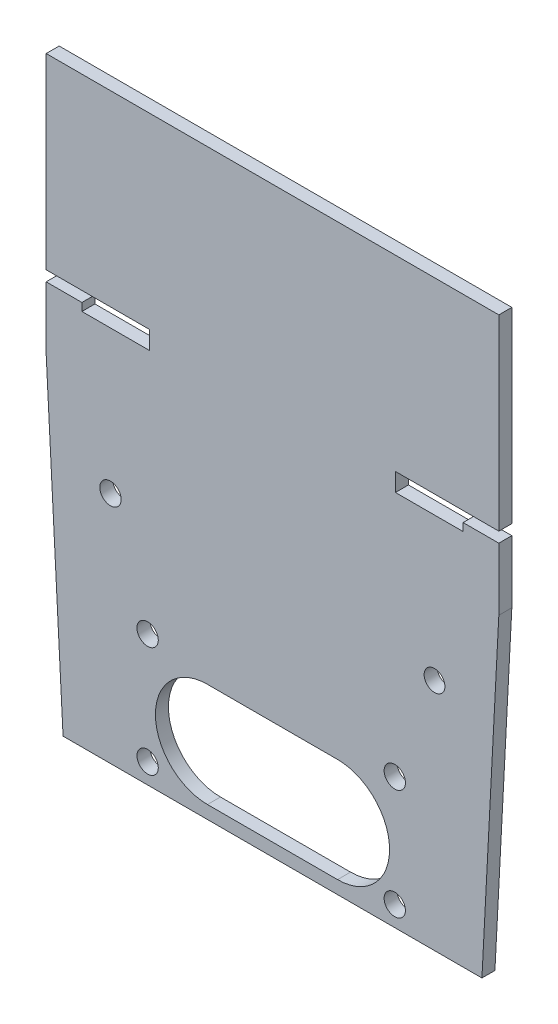
from build123d import *

# Parameters (mm, degrees)
BOSS_EXTRUDE1_DEPTH     = 5
CHAMFER1_SIZE           = 2
BOSS_EXTRUDE4_START     = 80
BOSS_EXTRUDE4_OUTLINE_W = 26
BOSS_EXTRUDE4_OUTLINE_H = 5
BOSS_EXTRUDE4_DEPTH     = 3
SKETCH2_R               = 4.1
SKETCH2_R_2             = 4
CUT_EXTRUDE2_DEPTH      = 36.925038653
SKETCH4_R               = 4.1
CUT_EXTRUDE3_DEPTH      = 9.191294825
SKETCH5_W               = 174
SKETCH5_H               = 5
BOSS_EXTRUDE5_DEPTH     = 50


with BuildPart() as part:
    # Boss-Extrude1: read off the stored shape, not the designer's step
    # Boss-Extrude1 outline → Boss-Extrude1 (new body)
    with BuildSketch(Plane.XY):
        Polygon((-87, 62), (-80.501435369, -62), (80.501435369, -62), (87, 62), (87, 86), (73.257786703, 86), (73.257786703, 83), (47.257786703, 83), (47.257786703, 90), (87, 90), (87, 112), (-87, 112), (-87, 90), (-47.257786703, 90), (-47.257786703, 83), (-73.257786703, 83), (-73.257786703, 86), (-87, 86), align=None)
        with BuildLine():
            Line((-25, -17), (25, -17))
            ThreePointArc((25, -17), (45, -37), (25, -57))
            Line((25, -57), (-25, -57))
            ThreePointArc((-25, -57), (-45, -37), (-25, -17))
        make_face(mode=Mode.SUBTRACT)
    extrude(amount=BOSS_EXTRUDE1_DEPTH)

    # Chamfer1
    chamfer1_edges = [part.edges().sort_by_distance(p)[0] for p in [
        (60.257786703, 83, 5),
        (-60.257786703, 83, 5),
    ]]
    chamfer(chamfer1_edges, length=CHAMFER1_SIZE)

    # Boss-Extrude4: read off the stored shape, not the designer's step
    # Boss-Extrude4 outline → Boss-Extrude4 (add)
    with BuildSketch(Plane(origin=(0, 0, 0), x_dir=(1, 0, 0), z_dir=(0, 1, 0)).offset(BOSS_EXTRUDE4_START)):
        with Locations((60.257786703, -2.5)):
            Rectangle(BOSS_EXTRUDE4_OUTLINE_W, BOSS_EXTRUDE4_OUTLINE_H)
        with Locations((-60.257786703, -2.5)):
            Rectangle(BOSS_EXTRUDE4_OUTLINE_W, BOSS_EXTRUDE4_OUTLINE_H)
    extrude(amount=BOSS_EXTRUDE4_DEPTH)

    # Sketch2 → Cut-Extrude2 (cut)
    with BuildSketch(Plane.XY.offset(5)):
        with Locations((-62.28149578, 27.917996168)):
            Circle(SKETCH2_R)
        with Locations((62.28149578, 27.917996168)):
            Circle(SKETCH2_R_2)
    extrude(amount=-CUT_EXTRUDE2_DEPTH, mode=Mode.SUBTRACT)

    # Sketch4 → Cut-Extrude3 (cut)
    with BuildSketch(Plane(origin=(0, 0, 0), x_dir=(-1, 0, 0), z_dir=(0, 0, -1))):
        with Locations((-47.001300636, -11.749189401)):
            Circle(SKETCH4_R)
        with Locations((47.999909157, -11.750133675)):
            Circle(SKETCH4_R)
        with Locations((47.999996185, -54.249608673)):
            Circle(SKETCH4_R)
        with Locations((-46.999683563, -54.249320844)):
            Circle(SKETCH4_R)
    extrude(amount=-CUT_EXTRUDE3_DEPTH, mode=Mode.SUBTRACT)

    # Sketch5 → Boss-Extrude5 (add)
    with BuildSketch(Plane(origin=(0, 112, 0), x_dir=(1, 0, 0), z_dir=(0, 1, 0))):
        with Locations((0, -2.5)):
            Rectangle(SKETCH5_W, SKETCH5_H)
    extrude(amount=BOSS_EXTRUDE5_DEPTH)


solid = part.part
